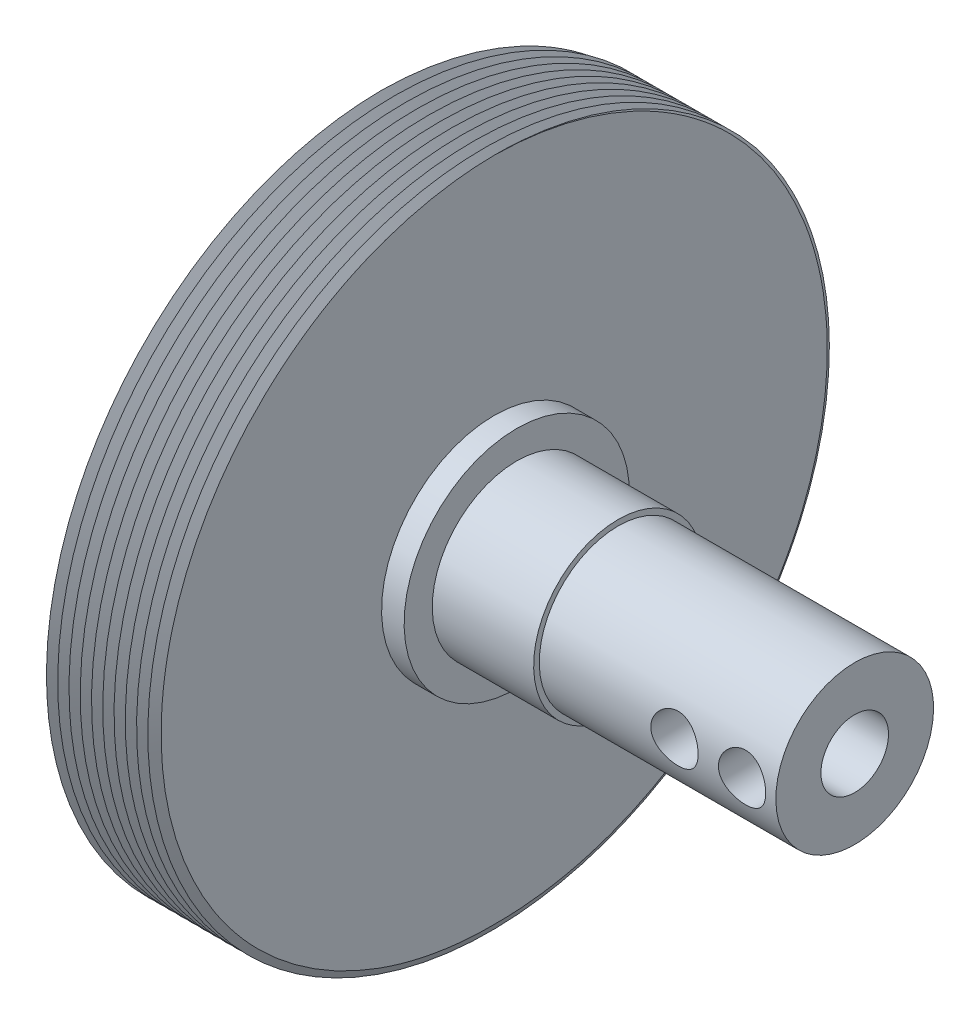
from build123d import *

# Parameters (mm, degrees)
CUT_SWEEP1_PITCH          = 1
M5X0_8_TAPPED_HOLE1_D     = 4.2
M5X0_8_TAPPED_HOLE1_DEPTH = 7
M5X0_8_TAPPED_HOLE1_TIP   = 1.2618073


with BuildPart() as part:
    # Sketch1 → Revolve1 (revolve)
    with BuildSketch(Plane.XY):
        Polygon((0, 0), (0, 30), (10, 30), (10, 10), (12, 10), (12, 7.5), (21, 7.5), (21, 7), (42, 7), (42, 3), (30, 3), (28.197418143, 0), align=None)
    revolve(axis=Axis((28.197418143, 0, 0), (-1, 0, 0)))

    # Cut-Sweep1: the profile of Sketch2 screwed along a right-hand helix of 50 turns, 8 arcs to a turn; built about Z, then put on its axis
    cut_sweep1_z = Axis((0, 0, 0), (0, 0, 1))
    cut_sweep1_corners = [(30, 0, 0), (29.133974596, 0, -0.5), (30, 0, -1), (31, 0, -1), (31, 0, 0)]
    with BuildLine(mode=Mode.PRIVATE) as cut_sweep1_profile:
        Line(cut_sweep1_corners[0], cut_sweep1_corners[1])
        Line(cut_sweep1_corners[1], cut_sweep1_corners[2])
        Line(cut_sweep1_corners[2], cut_sweep1_corners[3])
        Line(cut_sweep1_corners[3], cut_sweep1_corners[4])
        Line(cut_sweep1_corners[4], cut_sweep1_corners[0])
    cut_sweep1_cap = Face(cut_sweep1_profile.wire())
    cut_sweep1_turn_angles = [0, 22.5, 45, 67.5, 90, 112.5, 135, 157.5, 180, 202.5, 225, 247.5, 270, 292.5, 315, 337.5, 360]
    cut_sweep1_turn_weights = [1, 0.9238795325112867, 1, 0.9238795325112867, 1, 0.9238795325112867, 1, 0.9238795325112867, 1, 0.9238795325112867, 1, 0.9238795325112867, 1, 0.9238795325112867, 1, 0.9238795325112867, 1]
    cut_sweep1_turn_rails = [Edge.make_bspline([Vector(p[0], p[1], 0).rotate(cut_sweep1_z, cut_sweep1_turn_angles[k]) / cut_sweep1_turn_weights[k] + Vector(0, 0, p[2] + CUT_SWEEP1_PITCH * cut_sweep1_turn_angles[k] / 360) for k in range(17)], [0, 0, 0, 1, 1, 2, 2, 3, 3, 4, 4, 5, 5, 6, 6, 7, 7, 8, 8, 8], 2, cut_sweep1_turn_weights) for p in cut_sweep1_corners]
    cut_sweep1_turn_sides = [Face.make_surface_from_curves(cut_sweep1_turn_rails[p[0]], cut_sweep1_turn_rails[p[1]]) for p in [(0, 1), (1, 2), (2, 3), (3, 4), (4, 0)]]
    cut_sweep1_turn = Solid(Shell([*cut_sweep1_turn_sides, cut_sweep1_cap, cut_sweep1_cap.rotate(cut_sweep1_z, 360).moved(Location((0, 0, CUT_SWEEP1_PITCH * 360 / 360)))]))
    cut_sweep1_each = [*[cut_sweep1_turn.moved(Location((0, 0, CUT_SWEEP1_PITCH * i))) for i in range(50)]]
    add(Plane(origin=(0, 0, 0), x_dir=(0, 1, 0), z_dir=(1, 0, 0)) * Compound([cut_sweep1_each[i] for i in range(0, 50, 2)]), mode=Mode.SUBTRACT)
    add(Plane(origin=(0, 0, 0), x_dir=(0, 1, 0), z_dir=(1, 0, 0)) * Compound([cut_sweep1_each[i] for i in range(1, 50, 2)]), mode=Mode.SUBTRACT)

    # M5x0.8 Tapped Hole1
    with Locations(Plane.XY.offset(7)):
        with Locations((39, 0), (33, 0)):
            Hole(M5X0_8_TAPPED_HOLE1_D / 2, depth=M5X0_8_TAPPED_HOLE1_DEPTH)
            with Locations((0, 0, -(M5X0_8_TAPPED_HOLE1_DEPTH + M5X0_8_TAPPED_HOLE1_TIP / 2))):  # 118° drill point
                Cone(0, M5X0_8_TAPPED_HOLE1_D / 2, M5X0_8_TAPPED_HOLE1_TIP, mode=Mode.SUBTRACT)


solid = part.part
